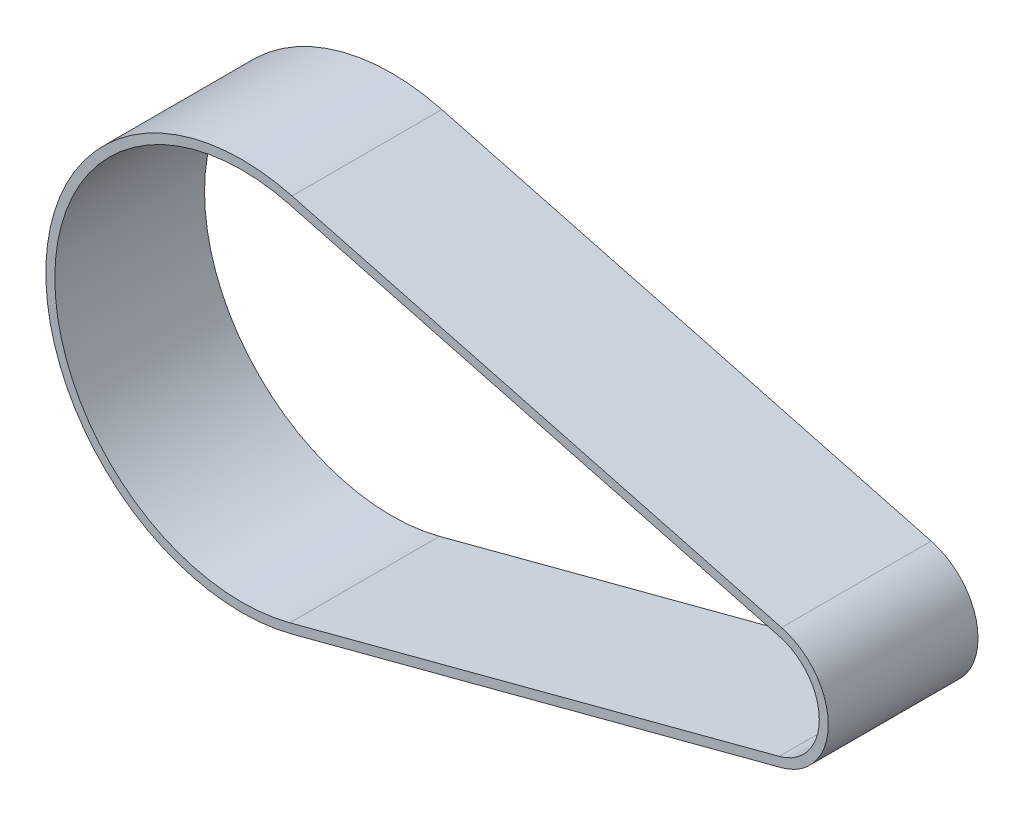
from build123d import *

# Parameters (mm, degrees)
BOSS_EXTRUDE1_DEPTH = 25


with BuildPart() as part:
    # Sketch1 → Boss-Extrude1 (new body)
    with BuildSketch(Plane.XY):
        with BuildLine():
            Line((-79.0488542, 31.677681423), (2.671559792, 10.133763776))
            ThreePointArc((2.671559792, 10.133763776), (10.48, 0), (2.671559792, -10.133763776))
            Line((2.671559792, -10.133763776), (-79.0488542, -31.677681423))
            ThreePointArc((-79.0488542, -31.677681423), (-120.16002775, 0), (-79.0488542, 31.677681423))
        make_face()
        with BuildLine():
            Line((-79.431233941, 30.227238134), (2.289180051, 8.683320488))
            ThreePointArc((2.289180051, 8.683320488), (8.98, 0), (2.289180051, -8.683320488))
            Line((2.289180051, -8.683320488), (-79.431233941, -30.227238134))
            ThreePointArc((-79.431233941, -30.227238134), (-118.66002775, 0), (-79.431233941, 30.227238134))
        make_face(mode=Mode.SUBTRACT)
    extrude(amount=BOSS_EXTRUDE1_DEPTH)


solid = part.part
